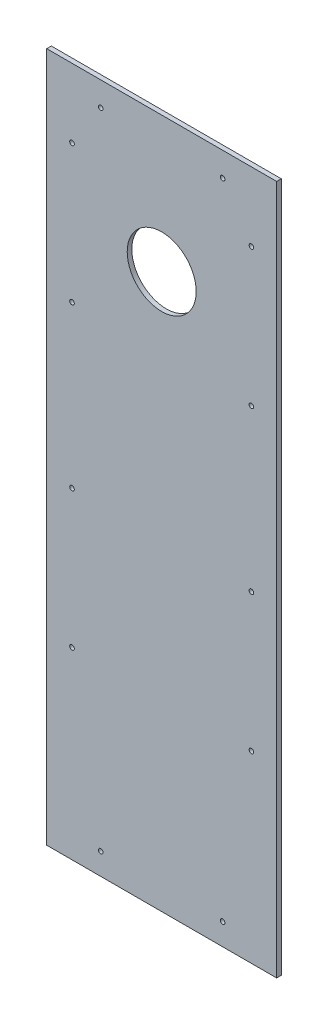
from build123d import *

# Parameters (mm, degrees)
SKETCH1_W           = 100
SKETCH1_H           = 300
BOSS_EXTRUDE1_DEPTH = 2
SKETCH2_R           = 1
CUT_EXTRUDE1_DEPTH  = 10
SKETCH3_R           = 15
CUT_EXTRUDE2_DEPTH  = 10
SKETCH4_R           = 1
CUT_EXTRUDE3_DEPTH  = 10


with BuildPart() as part:
    # Sketch1 → Boss-Extrude1 (new body)
    with BuildSketch(Plane.XY):
        Rectangle(SKETCH1_W, SKETCH1_H)
    extrude(amount=BOSS_EXTRUDE1_DEPTH)

    # Sketch2 → Cut-Extrude1 (cut)
    with BuildSketch(Plane.XY.offset(2)):
        with Locations((-39, 120)):
            Circle(SKETCH2_R)
        with Locations((-39, -70)):
            Circle(SKETCH2_R)
        with Locations((-39, -10)):
            Circle(SKETCH2_R)
        with Locations((-39, 60)):
            Circle(SKETCH2_R)
        with Locations((39, -70)):
            Circle(SKETCH2_R)
        with Locations((39, -10)):
            Circle(SKETCH2_R)
        with Locations((39, 60)):
            Circle(SKETCH2_R)
        with Locations((39, 120)):
            Circle(SKETCH2_R)
    extrude(amount=-CUT_EXTRUDE1_DEPTH, mode=Mode.SUBTRACT)

    # Sketch3 → Cut-Extrude2 (cut)
    with BuildSketch(Plane(origin=(0, 0, 0), x_dir=(-1, 0, 0), z_dir=(0, 0, -1))):
        with Locations((0, 91)):
            Circle(SKETCH3_R)
    extrude(amount=-CUT_EXTRUDE2_DEPTH, mode=Mode.SUBTRACT)

    # Sketch4 → Cut-Extrude3 (cut)
    with BuildSketch(Plane(origin=(0, 0, 0), x_dir=(-1, 0, 0), z_dir=(0, 0, -1))):
        with Locations((-26.5, 139.5)):
            Circle(SKETCH4_R)
        with Locations((26.5, 139.5)):
            Circle(SKETCH4_R)
        with Locations((-26.5, -140.5)):
            Circle(SKETCH4_R)
        with Locations((26.5, -140.5)):
            Circle(SKETCH4_R)
    extrude(amount=-CUT_EXTRUDE3_DEPTH, mode=Mode.SUBTRACT)


solid = part.part
